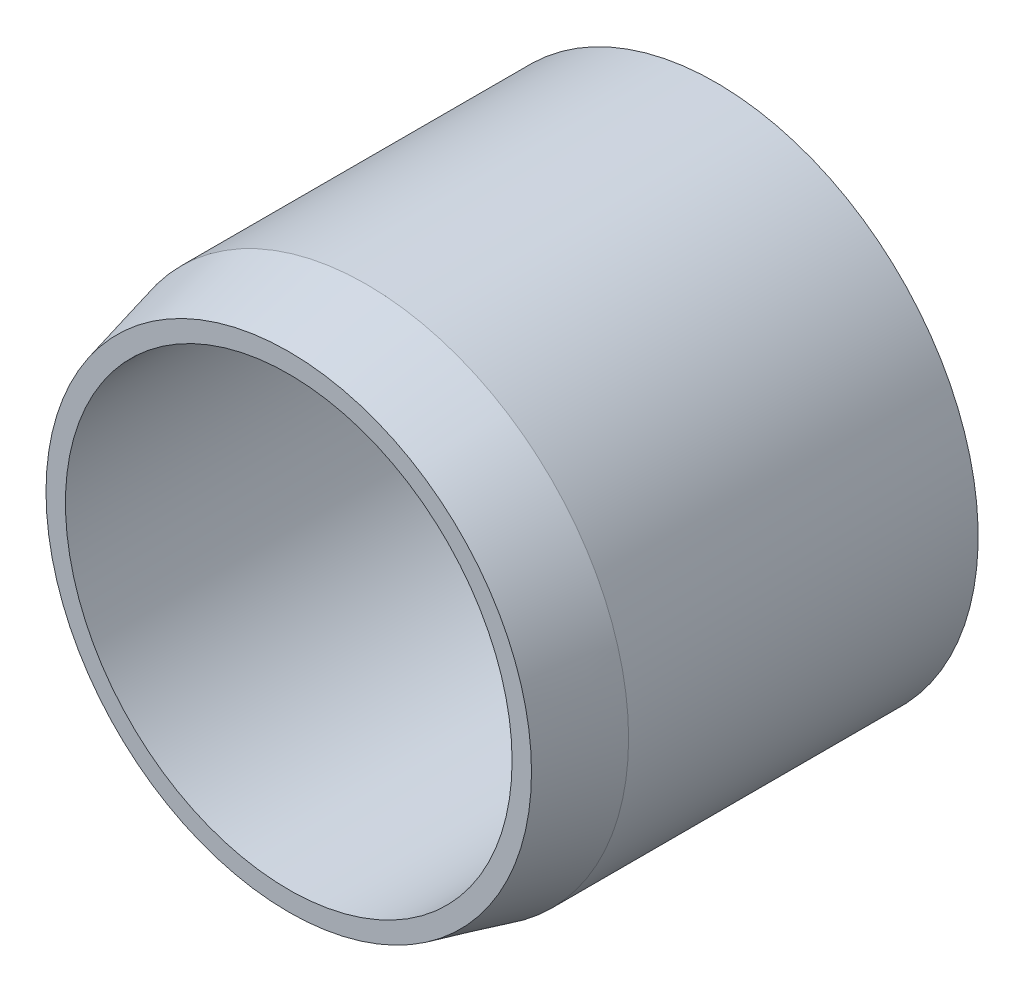
from build123d import *

# Parameters (mm, degrees)
SKETCH1_R           = 13.5
SKETCH1_R_2         = 11.5
EXTRUDE_THIN2_DEPTH = 16
BOSS_EXTRUDE1_START = 2
SKETCH2_R           = 13.5
BOSS_EXTRUDE1_DEPTH = 2
SKETCH3_R           = 12.5
SKETCH3_R_2         = 11.5
EXTRUDE_THIN3_DEPTH = 4
CHAMFER1_SIZE       = 1
CHAMFER1_SIZE_2     = 4


with BuildPart() as part:
    # Sketch1 → Extrude-Thin2 (new body)
    with BuildSketch(Plane.XY):
        Circle(SKETCH1_R)
        Circle(SKETCH1_R_2, mode=Mode.SUBTRACT)
    extrude(amount=EXTRUDE_THIN2_DEPTH)

    # Sketch2 → Boss-Extrude1 (add)
    with BuildSketch(Plane(origin=(0, 0, 0), x_dir=(-1, 0, 0), z_dir=(0, 0, -1)).offset(BOSS_EXTRUDE1_START)):
        Circle(SKETCH2_R)
    extrude(amount=-BOSS_EXTRUDE1_DEPTH)

    # Sketch3 → Extrude-Thin3 (add)
    with BuildSketch(Plane.XY.offset(16)):
        Circle(SKETCH3_R)
        Circle(SKETCH3_R_2, mode=Mode.SUBTRACT)
    extrude(amount=EXTRUDE_THIN3_DEPTH)

    # Chamfer1
    # the kernel refuses this chamfer: 4, 1 mm, written as the material it adds along each edge
    with BuildSketch(Plane(origin=(0, 0, 16), x_dir=(1, 0, 0), z_dir=(0, -1, 0))) as chamfer1_piece_1_section:
        Polygon((12.5 + CHAMFER1_SIZE, 0), (12.5, CHAMFER1_SIZE_2), (12.5, 0), align=None)
    chamfer1_piece_1 = revolve(axis=Axis((0, 0, 16), (0, 0, 1)), mode=Mode.PRIVATE)
    chamfer1_piece_1 = chamfer1_piece_1 & Plane(origin=(0, 0, 17.985898728), x_dir=(1, 0, 0), z_dir=(0, 0, -1)) * Cylinder(13.5, 54, mode=Mode.PRIVATE)
    chamfer1_piece_1 = split(chamfer1_piece_1, bisect_by=Plane(origin=(-12.943594911, 0, 20), z_dir=(0, 0, -1)), keep=Keep.TOP, mode=Mode.PRIVATE)
    add(chamfer1_piece_1)


solid = part.part
